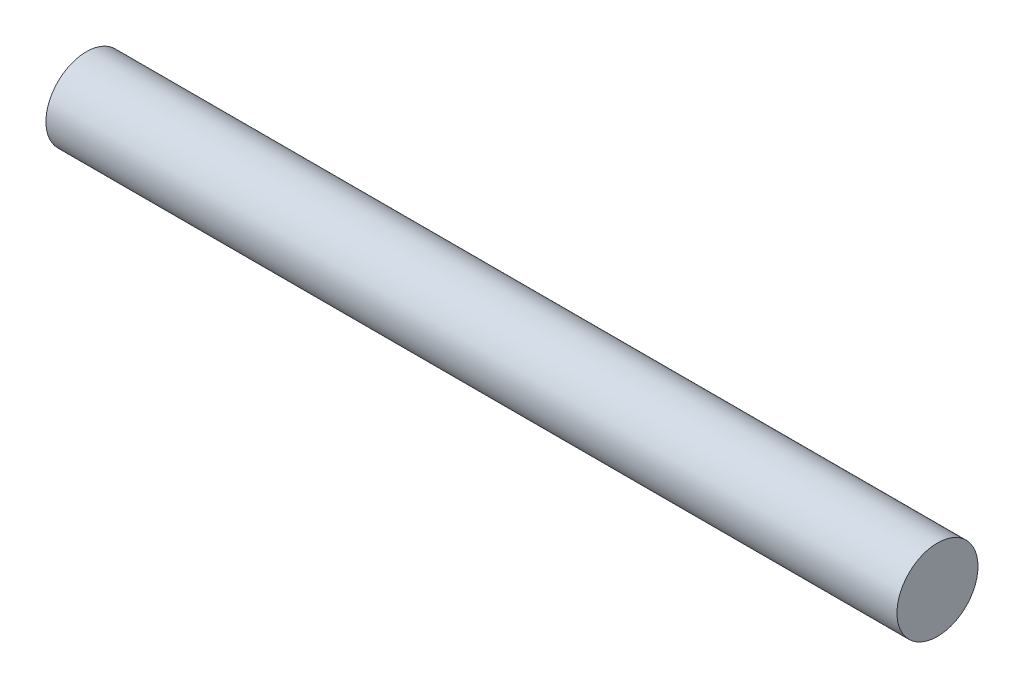
from build123d import *

# Parameters (mm, degrees)
SKETCH2_R           = 6.35
BOSS_EXTRUDE1_DEPTH = 66.675


with BuildPart() as part:
    # Sketch2 → Boss-Extrude1 (new, symmetric)
    with BuildSketch(Plane(origin=(0, 0, 0), x_dir=(0, 0, -1), z_dir=(1, 0, 0))):
        Circle(SKETCH2_R)
    extrude(amount=BOSS_EXTRUDE1_DEPTH, both=True)


solid = part.part
